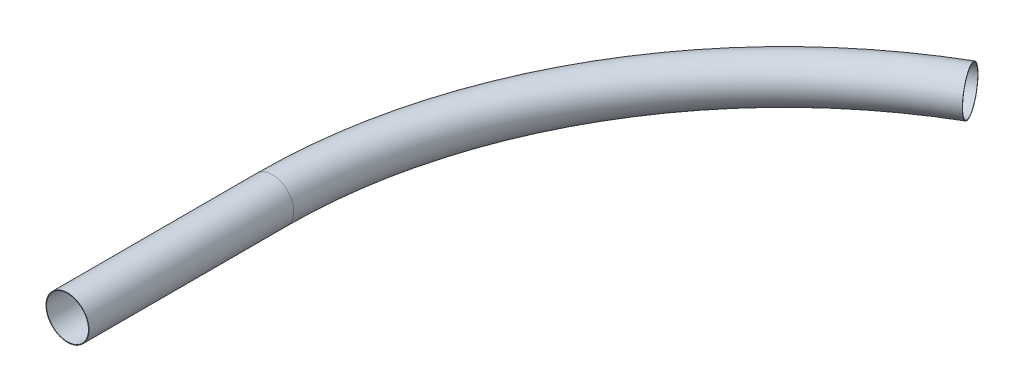
from build123d import *

# Parameters (mm, degrees)
SKETCH_1_R      = 210
SKETCH_1_R_2    = 205
SKETCH_3_R      = 210
SKETCH_3_R_2    = 205
EXTRUDE_1_DEPTH = 1000


with BuildPart() as part:
    # 扫描1: sweep along a path in 草图2
    with BuildLine(Plane(origin=(0, 0, 0), x_dir=(1, 0, 0), z_dir=(0, 1, 0))) as sweep_1_path:
        Line((0, 0), (0, 1000))
        ThreePointArc((0, 1000), (667.42667475, 3495.758077484), (2491.523352531, 5325.221949115))
    # 草图1 → 扫描1 (sweep)
    with BuildSketch(Plane.XY):
        Circle(SKETCH_1_R)
        Circle(SKETCH_1_R_2, mode=Mode.SUBTRACT)
    sweep(path=sweep_1_path.line)

    # 草图3 → 凸台-拉伸1 (add)
    with BuildSketch(Plane.XY):
        Circle(SKETCH_3_R)
        Circle(SKETCH_3_R_2, mode=Mode.SUBTRACT)
    extrude(amount=EXTRUDE_1_DEPTH)


solid = part.part
